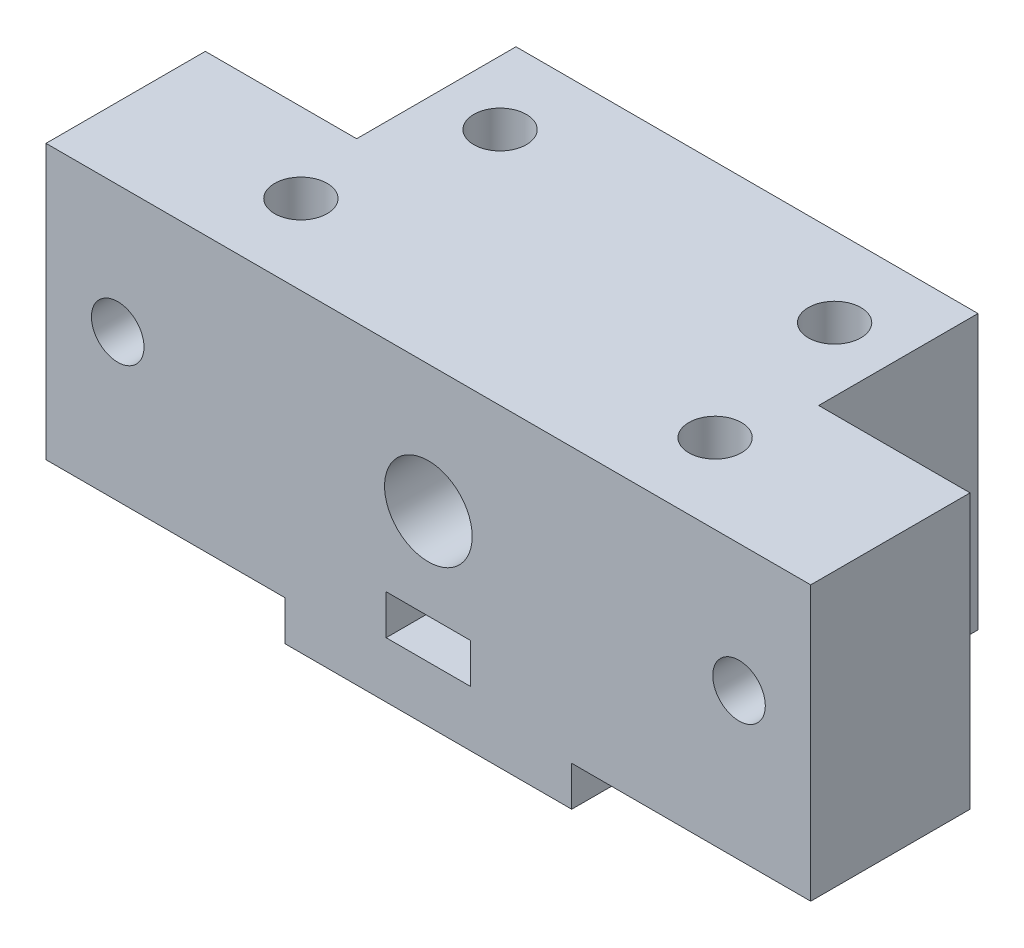
from build123d import *

# Parameters (mm, degrees)
SZKIC1_W                         = 48
SZKIC1_H                         = 17.2
DODANIE_WYCI_GNI_CIE1_DEPTH      = 10
SZKIC2_R                         = 1.65
WYTNIJ_WYCI_GNI_CIE1_DEPTH       = 10
SZKIC3_R                         = 2.75
WYTNIJ_WYCI_GNI_CIE2_DEPTH       = 10
SZKIC4_R                         = 1.65
WYTNIJ_WYCI_GNI_CIE3_DEPTH       = 17.2
SZKIC5_W                         = 29
SZKIC5_H                         = 17.2
SZKIC5_R                         = 2.75
DODANIE_WYCI_GNI_CIE2_DEPTH      = 10
SZKIC6_R                         = 1.65
WYTNIJ_WYCI_GNI_CIE4_DEPTH       = 17.2
SZKIC7_W                         = 15
SZKIC7_H                         = 9.959248908
WYTNIJ_WYCI_GNI_CIE5_DEPTH       = 0.1
SFAZOWANIE1_SIZE                 = 5
SZKIC9_R                         = 1.5
WYTNIJ_WYCI_GNI_CIE6_DEPTH       = 10
WYTNIJ_WYCI_GNI_CIE7_DEPTH       = 3.5
DODANIE_WYCI_GNI_CIE3_DEPTH      = 2.5
DODANIE_WYCI_GNI_CIE3_DEPTH_BACK = 1
SZKIC8_W                         = 18
SZKIC8_H                         = 10
WYTNIJ_WYCI_GNI_CIE8_START       = 7.5
SZKIC11_R                        = 1.5
WYTNIJ_WYCI_GNI_CIE8_DEPTH       = 7.5


with BuildPart() as part:
    # Szkic1 → Dodanie-wyciągnięcie1 (new body)
    with BuildSketch(Plane.XY):
        Rectangle(SZKIC1_W, SZKIC1_H)
    extrude(amount=DODANIE_WYCI_GNI_CIE1_DEPTH)

    # Szkic2 → Wytnij-wyciągnięcie1 (cut)
    with BuildSketch(Plane.XY.offset(10)):
        with Locations((-19.5, 0.6)):
            Circle(SZKIC2_R)
        with Locations((19.5, 0.6)):
            Circle(SZKIC2_R)
    extrude(amount=-WYTNIJ_WYCI_GNI_CIE1_DEPTH, mode=Mode.SUBTRACT)

    # Szkic3 → Wytnij-wyciągnięcie2 (cut)
    with BuildSketch(Plane.XY.offset(10)):
        with Locations((0, 0.6)):
            Circle(SZKIC3_R)
    extrude(amount=-WYTNIJ_WYCI_GNI_CIE2_DEPTH, mode=Mode.SUBTRACT)

    # Szkic4 → Wytnij-wyciągnięcie3 (cut)
    with BuildSketch(Plane.XZ.offset(8.6)):
        with Locations(Location((-13, 5, 0), (0, 0, 270))):
            Circle(SZKIC4_R)
        with Locations(Location((13, 5, 0), (0, 0, 270))):
            Circle(SZKIC4_R)
    extrude(amount=-WYTNIJ_WYCI_GNI_CIE3_DEPTH, mode=Mode.SUBTRACT)

    # Szkic5 → Dodanie-wyciągnięcie2 (add)
    with BuildSketch(Plane(origin=(0, 0, 0), x_dir=(-1, 0, 0), z_dir=(0, 0, -1))):
        Rectangle(SZKIC5_W, SZKIC5_H)
        with Locations(Location((0, 0.6, 0), (0, 0, 180))):
            Circle(SZKIC5_R, mode=Mode.SUBTRACT)
    extrude(amount=DODANIE_WYCI_GNI_CIE2_DEPTH)

    # Szkic6 → Wytnij-wyciągnięcie4 (cut)
    with BuildSketch(Plane(origin=(0, 8.6, 0), x_dir=(1, 0, 0), z_dir=(0, 1, 0))):
        with Locations(Location((-10.5, 5, 0), (0, 0, 270))):
            Circle(SZKIC6_R)
        with Locations(Location((10.5, 5, 0), (0, 0, 270))):
            Circle(SZKIC6_R)
    extrude(amount=-WYTNIJ_WYCI_GNI_CIE4_DEPTH, mode=Mode.SUBTRACT)

    # Szkic7 → Wytnij-wyciągnięcie5 (cut)
    with BuildSketch(Plane(origin=(0, 0, -10), x_dir=(-1, 0, 0), z_dir=(0, 0, -1))):
        with Locations((0, -8.6)):
            Rectangle(SZKIC7_W, SZKIC7_H)
    extrude(amount=-WYTNIJ_WYCI_GNI_CIE5_DEPTH, mode=Mode.SUBTRACT)

    # Sfazowanie1
    # the kernel refuses this chamfer: 5 mm, written as the material it takes off along each edge
    with BuildSketch(Plane(origin=(-7.5, -8.6, -9.9), x_dir=(0, -0.027495876610586317, 0.9996219169112968), z_dir=(1, 0, 0))) as sfazowanie1_piece_1_section:
        Polygon((SFAZOWANIE1_SIZE * 0.999621916911, -SFAZOWANIE1_SIZE * 0.0274958766106), (-SFAZOWANIE1_SIZE * 0.0274958766106, -SFAZOWANIE1_SIZE * 0.999621916911), (0, 0), align=None)
    sfazowanie1_piece_1 = extrude(amount=15, mode=Mode.PRIVATE)
    sfazowanie1_piece_1 = split(sfazowanie1_piece_1, bisect_by=Plane(origin=(0, -3.620375546, -8.233305768), z_dir=(0, -1, 0)), keep=Keep.TOP, mode=Mode.PRIVATE)
    add(sfazowanie1_piece_1, mode=Mode.SUBTRACT)

    # Szkic9 → Wytnij-wyciągnięcie6 (cut)
    with BuildSketch(Plane.XZ.offset(8.6)):
        with Locations(Location((0, 5, 0), (0, 0, 270))):
            Circle(SZKIC9_R)
    extrude(amount=-WYTNIJ_WYCI_GNI_CIE6_DEPTH, mode=Mode.SUBTRACT)

    # Szkic10 → Wytnij-wyciągnięcie7 (cut)
    with BuildSketch(Plane.XZ.offset(8.6)):
        Polygon((-2.65, 6.529978213), (-2.65, 10), (2.65, 10), (2.65, 6.529978213), (2.65, 3.470021787), (0, 1.940043573), (-2.65, 3.470021787), align=None)
    extrude(amount=-WYTNIJ_WYCI_GNI_CIE7_DEPTH, mode=Mode.SUBTRACT)

    # Szkic8 → Dodanie-wyciągnięcie3 (add, two sides: drawn at the far end of the back side and taken through both)
    with BuildSketch(Plane.XZ.offset(8.6).offset(-DODANIE_WYCI_GNI_CIE3_DEPTH_BACK)):
        with Locations((0, 5)):
            Rectangle(SZKIC8_W, SZKIC8_H)
    extrude(amount=DODANIE_WYCI_GNI_CIE3_DEPTH + DODANIE_WYCI_GNI_CIE3_DEPTH_BACK)

    # Szkic11 → Wytnij-wyciągnięcie8 (cut)
    with BuildSketch(Plane.XZ.offset(5.1).offset(WYTNIJ_WYCI_GNI_CIE8_START)):
        with Locations(Location((0, 5, 0), (0, 0, 270))):
            Circle(SZKIC11_R)
    extrude(amount=-WYTNIJ_WYCI_GNI_CIE8_DEPTH, mode=Mode.SUBTRACT)


solid = part.part
